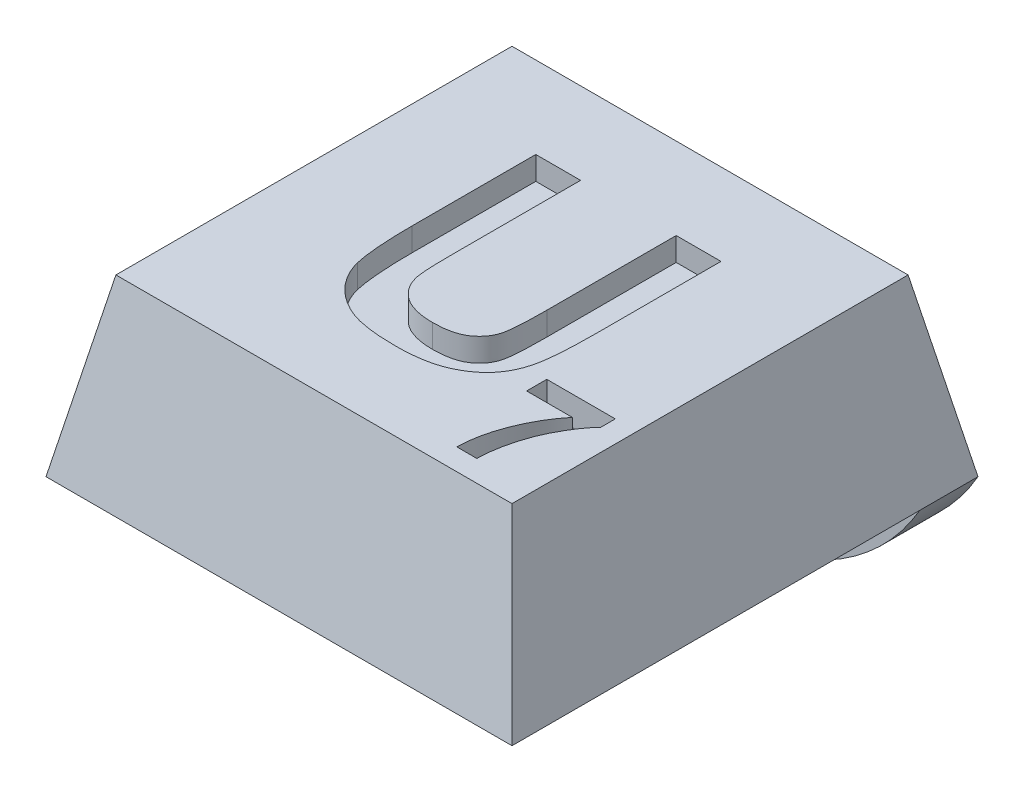
from build123d import *

# Parameters (mm, degrees)
SKETCH1_W               = 8
SKETCH1_H               = 8
BOSS_EXTRUDE1_DEPTH     = 3
CUT_EXTRUDE1_DEPTH      = 12.704699911
CUT_EXTRUDE1_DEPTH_BACK = 12.704699911
CUT_EXTRUDE2_DEPTH      = 11
SKETCH4_R               = 1.75
CUT_EXTRUDE3_DEPTH      = 0.4
SKETCH5_W               = 8
SKETCH5_H               = 1
BOSS_EXTRUDE2_DEPTH     = 2
FILLET1_R               = 4
CUT_EXTRUDE4_DEPTH      = 0.4
CUT_EXTRUDE5_DEPTH      = 0.5


with BuildPart() as part:
    # Sketch1 → Boss-Extrude1 (new body)
    with BuildSketch(Plane(origin=(0, 0, 0), x_dir=(1, 0, 0), z_dir=(0, 1, 0))):
        with Locations((4, 4)):
            Rectangle(SKETCH1_W, SKETCH1_H)
    extrude(amount=BOSS_EXTRUDE1_DEPTH)

    # Sketch2 → Cut-Extrude1 (cut, two sides: drawn at the far end of the back side and taken through both)
    with BuildSketch(Plane.XY.offset(-CUT_EXTRUDE1_DEPTH_BACK)):
        Polygon((0, 0), (0.6, 3), (0, 3), align=None)
        Polygon((8, 0), (7.4, 3), (8, 3), align=None)
    extrude(amount=CUT_EXTRUDE1_DEPTH + CUT_EXTRUDE1_DEPTH_BACK, mode=Mode.SUBTRACT)

    # Sketch3 → Cut-Extrude2 (cut)
    with BuildSketch(Plane(origin=(0, 0, 0), x_dir=(0, 0, -1), z_dir=(1, 0, 0))):
        Polygon((0, 0), (0.6, 3), (0, 3), align=None)
        Polygon((8, 3), (7.4, 3), (8, 0), align=None)
    extrude(amount=CUT_EXTRUDE2_DEPTH, mode=Mode.SUBTRACT)

    # Sketch4 → Cut-Extrude3 (cut)
    with BuildSketch(Plane.XZ):
        with Locations(Location((4, -3.75, 0), (0, 0, 270))):
            Circle(SKETCH4_R)
    extrude(amount=-CUT_EXTRUDE3_DEPTH, mode=Mode.SUBTRACT)

    # Sketch5 → Boss-Extrude2 (add)
    with BuildSketch(Plane.XZ):
        with Locations((4, -7.5)):
            Rectangle(SKETCH5_W, SKETCH5_H)
    extrude(amount=BOSS_EXTRUDE2_DEPTH)

    # Fillet1
    # the kernel refuses this fillet: 4 mm, written as the material it takes off along each edge
    with BuildSketch(Plane(origin=(8, -2, -16.660254038), x_dir=(0, 1, 0), z_dir=(0, 0, 1)), Plane(origin=(0, -2, 1.660254038), x_dir=(0, 1, 0), z_dir=(0, 0, -1))) as fillet1_piece_1:
        with BuildLine():
            CenterArc((4, 3.464101615), FILLET1_R, 180, 60)
            Line((0, 3.464101615), (-0.08, 3.464101615))
            Line((-0.08, 3.464101615), (-0.08, 0))
            Line((-0.08, 0), (0, -0.08))
            ThreePointArc((0, -0.08), (1, -0.08), (1.96, -0.069282032))
            Line((1.96, -0.069282032), (2, 0))
        make_face()
    extrude(amount=18.320508076, mode=Mode.SUBTRACT)

    # Sketch6 → Cut-Extrude4 (cut)
    with BuildSketch(Plane(origin=(0, 3, 0), x_dir=(1, 0, 0), z_dir=(0, 1, 0))):
        with BuildLine():
            Line((2.413140262, 5.995145478), (3.182371031, 5.995145478))
            Line((3.182371031, 5.995145478), (3.182371031, 3.824472401))
            add(Edge.make_bspline(
                [(3.182371031, 3.824472401), (3.182664695, 3.783339968), (3.183225327, 3.704814249), (3.183611242, 3.59262518), (3.18574694, 3.491896749), (3.190378411, 3.402466647), (3.193557117, 3.32438048), (3.199459629, 3.257623918), (3.205347836, 3.202222959), (3.211072588, 3.16927001), (3.213621031, 3.154600607)],
                knots=[0, 0, 0, 0, 1.470600056, 2.807515117, 4.011048972, 5.072079398, 6.00911328, 6.804506435, 7.467811572, 8, 8, 8, 8], degree=3))
            add(Edge.make_bspline(
                [(3.213621031, 3.154600607), (3.224127628, 3.115054038), (3.244816443, 3.03718185), (3.301842427, 2.930732637), (3.377172946, 2.83690436), (3.454012852, 2.769989694), (3.523520467, 2.722632459), (3.582561491, 2.693810163), (3.645203631, 2.667536787), (3.712771176, 2.647377448), (3.784538951, 2.629737301), (3.861373833, 2.619537644), (3.942627383, 2.611709661), (3.998321517, 2.610930314), (4.026922313, 2.610530094)],
                knots=[0, 0, 0, 0, 1.376921055, 2.711331395, 4.038631339, 5.418057255, 6.132954575, 6.870556231, 7.630397752, 8.422890386, 9.247036838, 10.121396817, 11.035274583, 12, 12, 12, 12], degree=3))
            add(Edge.make_bspline(
                [(4.026922313, 2.610530094), (4.055777389, 2.611053435), (4.111957634, 2.612072369), (4.193372399, 2.618140476), (4.269330983, 2.629588903), (4.339786919, 2.644600001), (4.40511233, 2.663571514), (4.464786061, 2.687591678), (4.518714075, 2.716497769), (4.582078678, 2.760066391), (4.650258908, 2.821527538), (4.715873674, 2.905091818), (4.762833649, 2.997337694), (4.784859868, 3.081565077), (4.796180605, 3.154949811), (4.803077806, 3.219164001), (4.809385646, 3.291832182), (4.815113647, 3.372755319), (4.819030865, 3.461994153), (4.821149619, 3.559774375), (4.82281709, 3.666080391), (4.823198873, 3.739802878), (4.823396672, 3.777998042)],
                knots=[0, 0, 0, 0, 1.036876239, 2.018776863, 2.930845756, 3.794842666, 4.605604932, 5.371924355, 6.101864688, 6.799283669, 8.1310906, 9.382718023, 10.597336334, 11.822035891, 12.492591141, 13.265194674, 14.141890321, 15.11351293, 16.179860579, 17.351049011, 18.627594861, 20, 20, 20, 20], degree=3))
            Line((4.823396672, 3.777998042), (4.823396672, 5.995145478))
            Line((4.823396672, 5.995145478), (5.592627441, 5.995145478))
            Line((5.592627441, 5.995145478), (5.592627441, 3.902998042))
            add(Edge.make_bspline(
                [(5.592627441, 3.902998042), (5.592528847, 3.845305157), (5.592339402, 3.734449864), (5.589381475, 3.574956755), (5.583094941, 3.428628514), (5.577830511, 3.295214312), (5.567675642, 3.175054503), (5.557043529, 3.068074376), (5.543346947, 2.974292627), (5.523815493, 2.867696041), (5.490991615, 2.748101531), (5.438090809, 2.615994056), (5.370481989, 2.495804532), (5.288434562, 2.387071806), (5.192421188, 2.289363714), (5.081004269, 2.203064381), (4.955329501, 2.127124651), (4.84016309, 2.072443299), (4.739752735, 2.035622669), (4.65797018, 2.010704116), (4.570444093, 1.989952175), (4.477277128, 1.973483664), (4.378429252, 1.959598273), (4.273864574, 1.950325107), (4.163741291, 1.944537997), (4.088628699, 1.944091898), (4.050159493, 1.943863427)],
                knots=[0, 0, 0, 0, 1.415574045, 2.719986624, 3.913607924, 5.00929969, 5.995467356, 6.871900228, 7.64671288, 8.320227872, 9.530145585, 10.682614022, 11.803571353, 12.90325401, 14.015460715, 15.154679255, 16.351678057, 17.612271512, 18.275764165, 18.974412946, 19.708786676, 20.481351116, 21.295095879, 22.157200529, 23.056203067, 24, 24, 24, 24], degree=3))
            add(Edge.make_bspline(
                [(4.050159493, 1.943863427), (4.00394899, 1.944454117), (3.914432357, 1.945598373), (3.784491522, 1.950702797), (3.663419731, 1.961238523), (3.550836598, 1.975478544), (3.446788608, 1.993784557), (3.351012543, 2.015669281), (3.264273035, 2.043328483), (3.160959321, 2.082832512), (3.045798952, 2.143260432), (2.920442018, 2.223870786), (2.810400187, 2.314853884), (2.716640343, 2.415320705), (2.638260762, 2.521740618), (2.574552012, 2.631810814), (2.523497916, 2.743696672), (2.502164616, 2.821459533), (2.491665903, 2.859728812)],
                knots=[0, 0, 0, 0, 1.128613534, 2.186292659, 3.174878439, 4.095586888, 4.95671962, 5.754129884, 6.492676435, 7.178284149, 8.453103036, 9.659838108, 10.813193309, 11.929983019, 13.007587775, 14.033493319, 15.032227051, 16, 16, 16, 16], degree=3))
            add(Edge.make_bspline(
                [(2.491665903, 2.859728812), (2.48524032, 2.889857793), (2.471705989, 2.953319061), (2.456334745, 3.054210037), (2.442311642, 3.165307899), (2.432733679, 3.286744058), (2.423654648, 3.418133217), (2.417136225, 3.559723113), (2.414455843, 3.711481594), (2.413587623, 3.816192051), (2.413140262, 3.870145478)],
                knots=[0, 0, 0, 0, 0.728071598, 1.533551606, 2.411422299, 3.374601532, 4.412367648, 5.524718474, 6.72457895, 8, 8, 8, 8], degree=3))
            Line((2.413140262, 3.870145478), (2.413140262, 5.995145478))
        make_face()
    extrude(amount=-CUT_EXTRUDE4_DEPTH, mode=Mode.SUBTRACT)

    # Sketch7 → Cut-Extrude5 (cut)
    with BuildSketch(Plane(origin=(0, 3, 0), x_dir=(1, 0, 0), z_dir=(0, 1, 0))):
        with BuildLine():
            Line((5.850386773, 2.400368579), (5.850386773, 2.746522425))
            Line((5.850386773, 2.746522425), (7.02730985, 2.746522425))
            Line((7.02730985, 2.746522425), (7.02730985, 2.492676271))
            add(Edge.make_bspline(
                [(7.02730985, 2.492676271), (7.015032321, 2.480184286), (6.989793248, 2.454504354), (6.953640746, 2.41247659), (6.916952595, 2.366869092), (6.880495981, 2.317067299), (6.84313767, 2.263857918), (6.806519427, 2.206220957), (6.769380335, 2.144904141), (6.719379376, 2.058171383), (6.660934493, 1.944871602), (6.599102899, 1.804034186), (6.546425212, 1.658871525), (6.510353845, 1.535182236), (6.485981829, 1.436045461), (6.470058334, 1.363554301), (6.45665413, 1.293103137), (6.44574982, 1.224568153), (6.437611625, 1.157918082), (6.431181064, 1.093384645), (6.428008496, 1.030810475), (6.427540351, 0.989794441), (6.42730985, 0.969599348)],
                knots=[0, 0, 0, 0, 0.628545797, 1.29210959, 1.98878689, 2.729126096, 3.507039704, 4.322017351, 5.179550397, 6.080149501, 7.915136253, 9.752312618, 11.597470118, 13.454141581, 14.373891568, 15.261584755, 16.117868869, 16.947726723, 17.752002974, 18.527724242, 19.275094557, 20, 20, 20, 20], degree=3))
            Line((6.42730985, 0.969599348), (6.081156004, 0.969599348))
            add(Edge.make_bspline(
                [(6.081156004, 0.969599348), (6.082313464, 1.000264514), (6.084641243, 1.061935513), (6.093350513, 1.15450167), (6.107029358, 1.247412503), (6.124019401, 1.340882746), (6.146450494, 1.434684851), (6.172051243, 1.529166286), (6.203062702, 1.623822431), (6.237825714, 1.718472296), (6.276202253, 1.812217257), (6.31802728, 1.903894573), (6.363192674, 1.992932291), (6.411111069, 2.079643245), (6.462339924, 2.16374848), (6.516917811, 2.245156666), (6.574070556, 2.324456683), (6.614935451, 2.375068877), (6.635362734, 2.400368579)],
                knots=[0, 0, 0, 0, 0.943249748, 1.896978291, 2.856365892, 3.829648507, 4.816416106, 5.820376826, 6.838120354, 7.877341886, 8.919613352, 9.951365796, 10.974227495, 11.988073359, 12.996274698, 14.000568529, 15.000536908, 16, 16, 16, 16], degree=3))
            Line((6.635362734, 2.400368579), (5.850386773, 2.400368579))
        make_face()
    extrude(amount=-CUT_EXTRUDE5_DEPTH, mode=Mode.SUBTRACT)


solid = part.part
